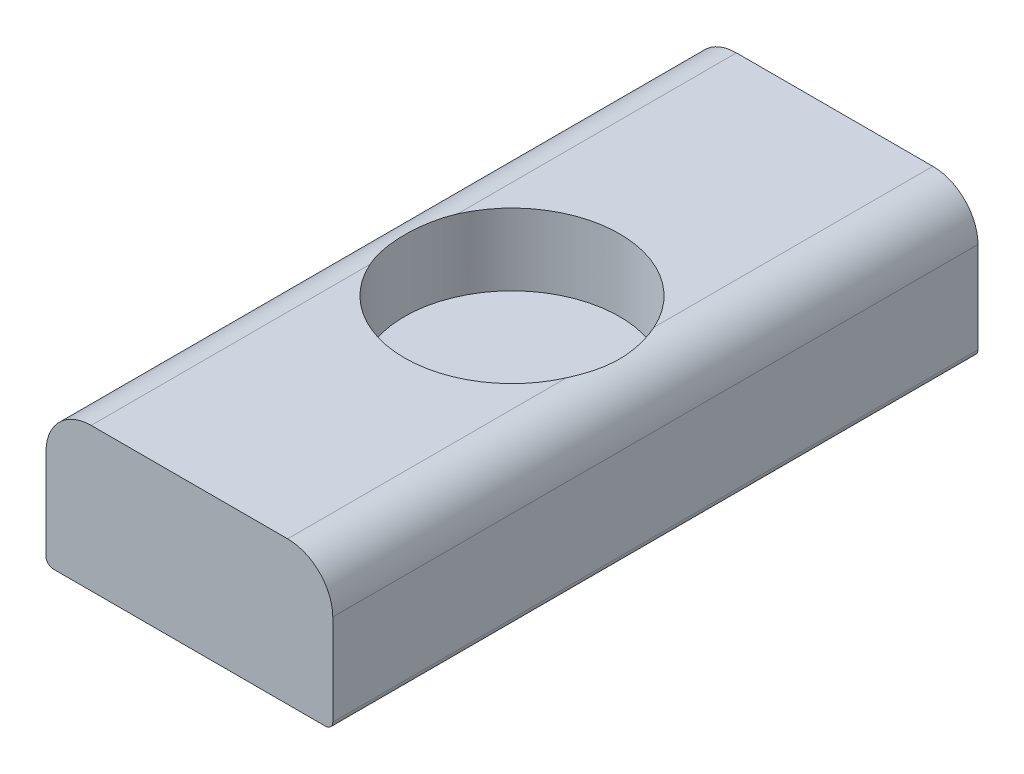
from build123d import *

# Parameters (mm, degrees)
SKETCH1_W           = 40
SKETCH1_H           = 20
BOSS_EXTRUDE1_DEPTH = 90
FILLET1_R           = 1
SKETCH2_R           = 15
CUT_EXTRUDE1_DEPTH  = 10
FILLET2_R           = 6.3


with BuildPart() as part:
    # Sketch1 → Boss-Extrude1 (new body)
    with BuildSketch(Plane.XY):
        Rectangle(SKETCH1_W, SKETCH1_H)
    extrude(amount=BOSS_EXTRUDE1_DEPTH)

    # Fillet1
    fillet1_edges = [part.edges().sort_by_distance(p)[0] for p in [
        (20, -10, 45),
        (-20, -10, 45),
    ]]
    fillet(fillet1_edges, radius=FILLET1_R)

    # Sketch2 → Cut-Extrude1 (cut)
    with BuildSketch(Plane(origin=(0, 10, 0), x_dir=(1, 0, 0), z_dir=(0, 1, 0))):
        with Locations(Location((0, -45, 0), (0, 0, 270))):
            Circle(SKETCH2_R)
    extrude(amount=-CUT_EXTRUDE1_DEPTH, mode=Mode.SUBTRACT)

    # Fillet2
    # the kernel refuses this fillet: 6.3 mm, written as the material it takes off along each edge
    with BuildSketch(Plane(origin=(-20, 10, -15.75), x_dir=(0, -1, 0), z_dir=(0, 0, 1))) as fillet2_piece_1:
        with BuildLine():
            CenterArc((FILLET2_R, FILLET2_R), FILLET2_R, 180, 90)
            Line((0, FILLET2_R), (0, 0))
            Line((0, 0), (FILLET2_R, 0))
        make_face()
    extrude(amount=121.5, mode=Mode.SUBTRACT)
    with BuildSketch(Plane(origin=(20, 10, -15.75), x_dir=(0, -1, 0), z_dir=(0, 0, 1))) as fillet2_piece_2:
        with BuildLine():
            CenterArc((FILLET2_R, -FILLET2_R), FILLET2_R, 90, 90)
            Line((0, -FILLET2_R), (0, 0))
            Line((0, 0), (FILLET2_R, 0))
        make_face()
    extrude(amount=121.5, mode=Mode.SUBTRACT)


solid = part.part
